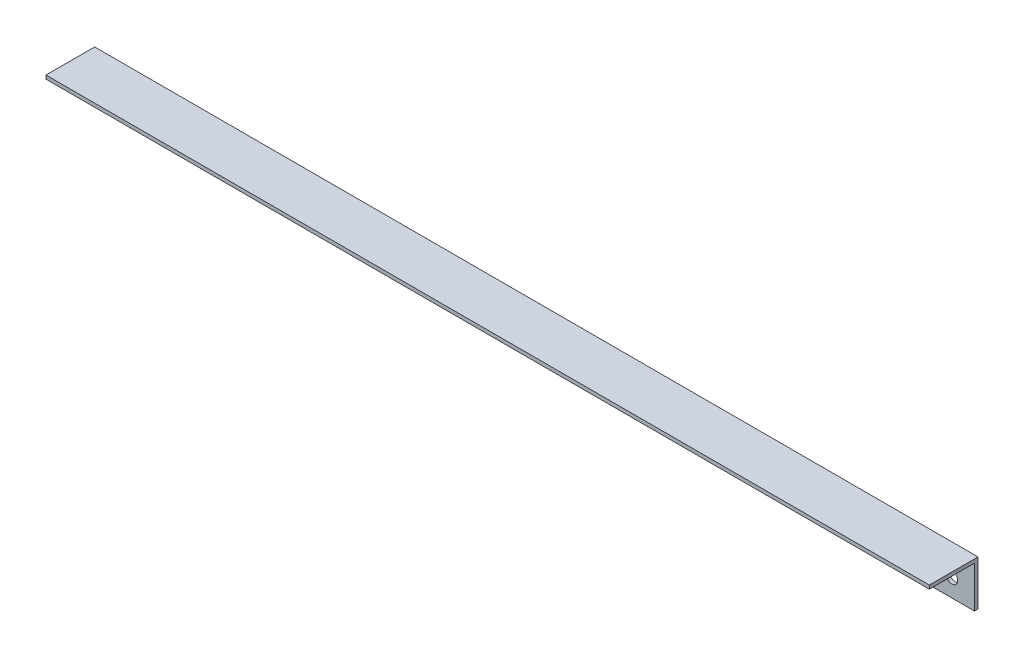
from build123d import *

# Parameters (mm, degrees)
SKETCH_1_W        = 1960
SKETCH_1_H        = 100
SKETCH_1_R        = 13
EXTRUDE_764_DEPTH = 8
SKETCH_2_W        = 1960
SKETCH_2_H        = 8
EXTRUDE_1_DEPTH   = 100


with BuildPart() as part:
    # 草图1 → Extrude 764 (new body)
    with BuildSketch(Plane.XY):
        with Locations((0, 44.512115183)):
            Rectangle(SKETCH_1_W, SKETCH_1_H)
        with Locations((930, 34.512115183)):
            Circle(SKETCH_1_R, mode=Mode.SUBTRACT)
        with Locations((850, 34.512115183)):
            Circle(SKETCH_1_R, mode=Mode.SUBTRACT)
        with Locations((770, 34.512115183)):
            Circle(SKETCH_1_R, mode=Mode.SUBTRACT)
        with Locations((330, 34.512115183)):
            Circle(SKETCH_1_R, mode=Mode.SUBTRACT)
        with Locations((250, 34.512115183)):
            Circle(SKETCH_1_R, mode=Mode.SUBTRACT)
        with Locations((-770, 34.512115183)):
            Circle(SKETCH_1_R, mode=Mode.SUBTRACT)
        with Locations((-850, 34.512115183)):
            Circle(SKETCH_1_R, mode=Mode.SUBTRACT)
        with Locations((170, 34.512115183)):
            Circle(SKETCH_1_R, mode=Mode.SUBTRACT)
        with Locations((-170, 34.512115183)):
            Circle(SKETCH_1_R, mode=Mode.SUBTRACT)
        with Locations((-250, 34.512115183)):
            Circle(SKETCH_1_R, mode=Mode.SUBTRACT)
        with Locations((-330, 34.512115183)):
            Circle(SKETCH_1_R, mode=Mode.SUBTRACT)
        with Locations((-930, 34.512115183)):
            Circle(SKETCH_1_R, mode=Mode.SUBTRACT)
    extrude(amount=EXTRUDE_764_DEPTH)

    # 草图2 → 凸台-拉伸1 (add)
    with BuildSketch(Plane.XY.offset(8)):
        with Locations((0, 90.512115183)):
            Rectangle(SKETCH_2_W, SKETCH_2_H)
    extrude(amount=EXTRUDE_1_DEPTH)


solid = part.part
